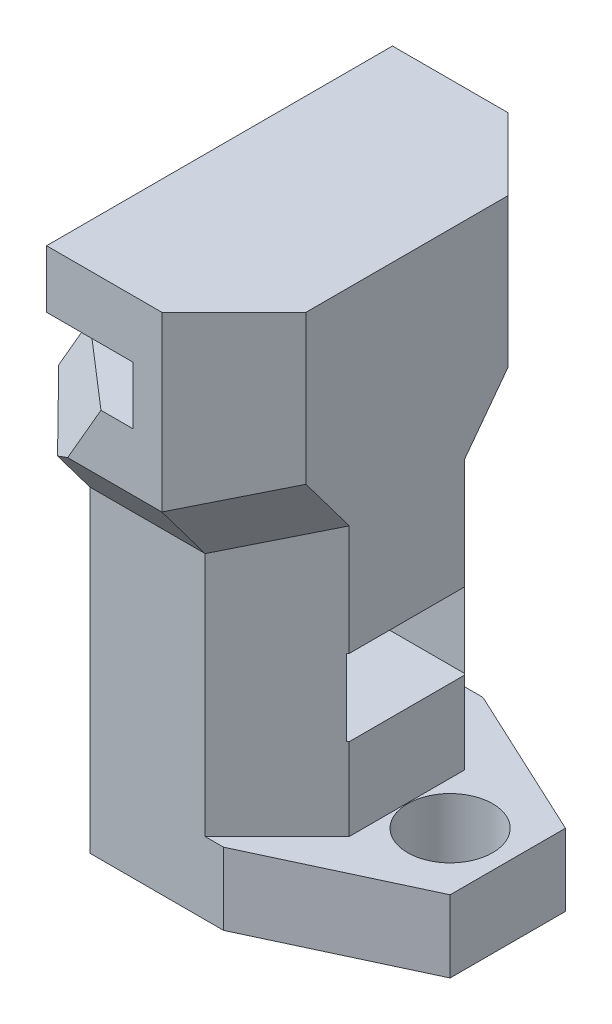
from build123d import *

# Parameters (mm, degrees)
BOSS_EXTRUDE1_DEPTH = 12
SKETCH2_R           = 5.25
CUT_EXTRUDE1_DEPTH  = 6
CHAMFER2_SIZE       = 3
CHAMFER2_SIZE2      = 5.196152423
SKETCH4_R           = 2.75
CUT_EXTRUDE3_DEPTH  = 28
CUT_EXTRUDE4_REACH  = 38.986
SKETCH5_W           = 8.2
SKETCH5_H           = 5.3
CUT_EXTRUDE6_REACH  = 38.986
CHAMFER3_SIZE       = 5
SKETCH8_R           = 2.95
BOSS_EXTRUDE2_DEPTH = 5
CHAMFER4_SIZE       = 5
CHAMFER4_SIZE2      = 10.722534603


with BuildPart() as part:
    # Sketch1 → Boss-Extrude1 (new, symmetric)
    with BuildSketch(Plane.XY):
        Polygon((-9, 8), (4, 8), (4, -30), (-14, -30), (-14, 0), (-3, 0), (-3, 4), (-9, 4), align=None)
    extrude(amount=BOSS_EXTRUDE1_DEPTH, both=True)

    # Sketch2 → Cut-Extrude1 (cut)
    with BuildSketch(Plane.XZ.offset(30)):
        with Locations((-5, 0)):
            Circle(SKETCH2_R)
    extrude(amount=-CUT_EXTRUDE1_DEPTH, mode=Mode.SUBTRACT)

    # Chamfer2
    chamfer2_edges = [part.edges().sort_by_distance(p)[0] for p in [
        (-14, 0, 0),
    ]]
    chamfer2_side = [part.faces().sort_by_distance(p)[0] for p in [
        (-8.5, 0, 0),
    ]]
    chamfer(chamfer2_edges, length=CHAMFER2_SIZE, length2=CHAMFER2_SIZE2, reference=chamfer2_side[0])

    # Sketch4 → Cut-Extrude3 (cut)
    with BuildSketch(Plane.XZ.offset(30)):
        with Locations((-5, 0)):
            Circle(SKETCH4_R)
    extrude(amount=-CUT_EXTRUDE3_DEPTH, mode=Mode.SUBTRACT)

    # Sketch5 → Cut-Extrude4 (cut, up to next)
    with BuildSketch(Plane(origin=(4, 0, 0), x_dir=(0, 0, -1), z_dir=(1, 0, 0)), mode=Mode.PRIVATE) as cut_extrude4_sk1:
        with Locations((0, -16.65)):
            Rectangle(SKETCH5_W, SKETCH5_H)
    cut_extrude4_tool1 = extrude(cut_extrude4_sk1.sketch, amount=-CUT_EXTRUDE4_REACH, mode=Mode.PRIVATE) & part.part
    add(cut_extrude4_tool1.solids().sort_by_distance((4, -16.65, 0))[0], mode=Mode.SUBTRACT)

    # Sketch7 → Cut-Extrude6 (cut, up to next)
    with BuildSketch(Plane(origin=(4, 0, 0), x_dir=(0, 0, -1), z_dir=(1, 0, 0)), mode=Mode.PRIVATE) as cut_extrude6_sk1:
        Polygon((-12, -30), (-12, -4), (-9, -8), (-9, -30), align=None)
    cut_extrude6_tool1 = extrude(cut_extrude6_sk1.sketch, amount=-CUT_EXTRUDE6_REACH, mode=Mode.PRIVATE) & part.part
    # Sketch7 → Cut-Extrude6 (cut, up to next)
    with BuildSketch(Plane(origin=(4, 0, 0), x_dir=(0, 0, -1), z_dir=(1, 0, 0)), mode=Mode.PRIVATE) as cut_extrude6_sk2:
        Polygon((9, -30), (12, -30), (12, -4), (9, -8), align=None)
    cut_extrude6_tool2 = extrude(cut_extrude6_sk2.sketch, amount=-CUT_EXTRUDE6_REACH, mode=Mode.PRIVATE) & part.part
    add(cut_extrude6_tool1.solids().sort_by_distance((4, -17.972222, 10.541667))[0], mode=Mode.SUBTRACT)
    add(cut_extrude6_tool2.solids().sort_by_distance((4, -17.972222, -10.541667))[0], mode=Mode.SUBTRACT)

    # Chamfer3
    # the kernel refuses this chamfer: 5 mm, written as the material it takes off along each edge
    with BuildSketch(Plane(origin=(4, 4.85841494, 9), x_dir=(0, 0, -1), z_dir=(0, -1, 0))) as chamfer3_piece_1_section:
        Polygon((CHAMFER3_SIZE, 0), (0, -CHAMFER3_SIZE), (0, 0), align=None)
    chamfer3_piece_1 = extrude(amount=47.71682988, mode=Mode.PRIVATE)
    chamfer3_piece_1 = split(chamfer3_piece_1, bisect_by=Plane(origin=(5.357524482, 4.043900251, 10.086019586), z_dir=(0.7071067811865478, -0.4242640687119279, 0.5656854249492383)), keep=Keep.TOP, mode=Mode.PRIVATE)
    add(chamfer3_piece_1, mode=Mode.SUBTRACT)
    with BuildSketch(Plane(origin=(4, 6.286731952, 19.715048964), x_dir=(0, 0.5999999999999992, -0.8000000000000004), z_dir=(0, -0.8000000000000005, -0.5999999999999993))) as chamfer3_piece_2_section:
        Polygon((CHAMFER3_SIZE, 0), (0, -CHAMFER3_SIZE), (0, 0), align=None)
    chamfer3_piece_2 = extrude(amount=30.71682988, mode=Mode.PRIVATE)
    chamfer3_piece_2 = split(chamfer3_piece_2, bisect_by=Plane(origin=(-3.857524482, 6.286731952, 11.857524482), z_dir=(0.7071067811865476, 0, 0.7071067811865476)), keep=Keep.TOP, mode=Mode.PRIVATE)
    add(chamfer3_piece_2, mode=Mode.SUBTRACT)
    with BuildSketch(Plane(origin=(4, 20.85841494, 12), x_dir=(0, 0, -1), z_dir=(0, -1, 0)), Plane(origin=(4, 20.85841494, -12), x_dir=(-1, 0, 0), z_dir=(0, -1, 0))) as chamfer3_piece_3:
        Polygon((CHAMFER3_SIZE, 0), (0, -CHAMFER3_SIZE), (0, 0), align=None)
    extrude(amount=37.71682988, mode=Mode.SUBTRACT)
    with BuildSketch(Plane(origin=(4, 6.286731952, -19.715048964), x_dir=(-1, 0, 0), z_dir=(0, -0.8000000000000006, 0.5999999999999993))) as chamfer3_piece_4_section:
        Polygon((CHAMFER3_SIZE, 0), (0, -CHAMFER3_SIZE), (0, 0), align=None)
    chamfer3_piece_4 = extrude(amount=30.71682988, mode=Mode.PRIVATE)
    chamfer3_piece_4 = split(chamfer3_piece_4, bisect_by=Plane(origin=(-3.857524482, 6.286731952, -11.857524482), z_dir=(0.7071067811865476, 0, -0.7071067811865476)), keep=Keep.TOP, mode=Mode.PRIVATE)
    add(chamfer3_piece_4, mode=Mode.SUBTRACT)
    with BuildSketch(Plane(origin=(4, 4.85841494, -9), x_dir=(0, 0, 1), z_dir=(0, -1, 0))) as chamfer3_piece_5_section:
        Polygon((CHAMFER3_SIZE, 0), (0, CHAMFER3_SIZE), (0, 0), align=None)
    chamfer3_piece_5 = extrude(amount=47.71682988, mode=Mode.PRIVATE)
    chamfer3_piece_5 = split(chamfer3_piece_5, bisect_by=Plane(origin=(5.357524482, 4.043900251, -10.086019586), z_dir=(0.7071067811865476, -0.424264068711928, -0.5656854249492386)), keep=Keep.TOP, mode=Mode.PRIVATE)
    add(chamfer3_piece_5, mode=Mode.SUBTRACT)
    with BuildSketch(Plane(origin=(-14, -42.85841494, -9), x_dir=(1, 0, 0), z_dir=(0, 1, 0))) as chamfer3_piece_6_section:
        Polygon((CHAMFER3_SIZE, 0), (0, -CHAMFER3_SIZE), (0, 0), align=None)
    chamfer3_piece_6 = extrude(amount=47.71682988, mode=Mode.PRIVATE)
    chamfer3_piece_6 = split(chamfer3_piece_6, bisect_by=Plane(origin=(-1.042475518, -35.083900251, 1.366019586), z_dir=(-0.7071067811865479, -0.42426406871192784, -0.5656854249492381)), keep=Keep.TOP, mode=Mode.PRIVATE)
    add(chamfer3_piece_6, mode=Mode.SUBTRACT)
    with BuildSketch(Plane(origin=(-14, -18.286731952, -1.284951036), x_dir=(1, 0, 0), z_dir=(0, 0.8000000000000006, -0.5999999999999993))) as chamfer3_piece_7_section:
        Polygon((CHAMFER3_SIZE, 0), (0, -CHAMFER3_SIZE), (0, 0), align=None)
    chamfer3_piece_7 = extrude(amount=29.221639351, mode=Mode.PRIVATE)
    chamfer3_piece_7 = split(chamfer3_piece_7, bisect_by=Plane(origin=(-15.357524482, -18.286731952, -2.642475518), z_dir=(-0.7071067811865476, 0, -0.7071067811865476)), keep=Keep.TOP, mode=Mode.PRIVATE)
    add(chamfer3_piece_7, mode=Mode.SUBTRACT)
    with BuildSketch(Plane(origin=(-4.57079253, 11.13571399, -12), x_dir=(0.8660254037844396, -0.49999999999999833, 0), z_dir=(-0.49999999999999833, -0.8660254037844397, 0))) as chamfer3_piece_8_section:
        Polygon((CHAMFER3_SIZE, 0), (0, CHAMFER3_SIZE), (0, 0), align=None)
    chamfer3_piece_8 = extrude(amount=30.335632033, mode=Mode.PRIVATE)
    chamfer3_piece_8 = split(chamfer3_piece_8, bisect_by=Plane(origin=(-4.57079253, 0, -12), z_dir=(0, -1, 0)), keep=Keep.TOP, mode=Mode.PRIVATE)
    add(chamfer3_piece_8, mode=Mode.SUBTRACT)
    with BuildSketch(Plane(origin=(-4.57079253, 11.13571399, 12), x_dir=(0, 0, -1), z_dir=(-0.49999999999999833, -0.8660254037844397, 0))) as chamfer3_piece_9_section:
        Polygon((CHAMFER3_SIZE, 0), (0, CHAMFER3_SIZE), (0, 0), align=None)
    chamfer3_piece_9 = extrude(amount=30.335632033, mode=Mode.PRIVATE)
    chamfer3_piece_9 = split(chamfer3_piece_9, bisect_by=Plane(origin=(-4.57079253, 0, 12), z_dir=(0, -1, 0)), keep=Keep.TOP, mode=Mode.PRIVATE)
    add(chamfer3_piece_9, mode=Mode.SUBTRACT)
    with BuildSketch(Plane(origin=(-14, -18.286731952, 1.284951036), x_dir=(0, 0.5999999999999993, -0.8000000000000005), z_dir=(0, 0.8000000000000005, 0.5999999999999993))) as chamfer3_piece_10_section:
        Polygon((CHAMFER3_SIZE, 0), (0, -CHAMFER3_SIZE), (0, 0), align=None)
    chamfer3_piece_10 = extrude(amount=29.221639351, mode=Mode.PRIVATE)
    chamfer3_piece_10 = split(chamfer3_piece_10, bisect_by=Plane(origin=(-15.357524482, -18.286731952, 2.642475518), z_dir=(-0.7071067811865476, 0, 0.7071067811865476)), keep=Keep.TOP, mode=Mode.PRIVATE)
    add(chamfer3_piece_10, mode=Mode.SUBTRACT)
    with BuildSketch(Plane(origin=(-14, -42.85841494, 9), x_dir=(0, 0, -1), z_dir=(0, 1, 0))) as chamfer3_piece_11_section:
        Polygon((CHAMFER3_SIZE, 0), (0, -CHAMFER3_SIZE), (0, 0), align=None)
    chamfer3_piece_11 = extrude(amount=47.71682988, mode=Mode.PRIVATE)
    chamfer3_piece_11 = split(chamfer3_piece_11, bisect_by=Plane(origin=(-1.042475518, -35.083900251, -1.366019586), z_dir=(-0.7071067811865476, -0.4242640687119281, 0.5656854249492385)), keep=Keep.TOP, mode=Mode.PRIVATE)
    add(chamfer3_piece_11, mode=Mode.SUBTRACT)

    # Sketch8 → Boss-Extrude2 (add)
    with BuildSketch(Plane.XZ.offset(30)):
        Polygon((4, 4), (-1, 9), (11, 9), (11, -9), (-1, -9), (4, -4), align=None)
        with Locations((7, 0)):
            Circle(SKETCH8_R, mode=Mode.SUBTRACT)
    extrude(amount=-BOSS_EXTRUDE2_DEPTH)

    # Chamfer4
    chamfer4_edges = [part.edges().sort_by_distance(p)[0] for p in [
        (11, -27.5, 9),
        (11, -27.5, -9),
    ]]
    chamfer4_side = [part.faces().sort_by_distance(p)[0] for p in [
        (11, -27.5, 0),
    ]]
    chamfer(chamfer4_edges, length=CHAMFER4_SIZE, length2=CHAMFER4_SIZE2, reference=chamfer4_side[0])


solid = part.part
